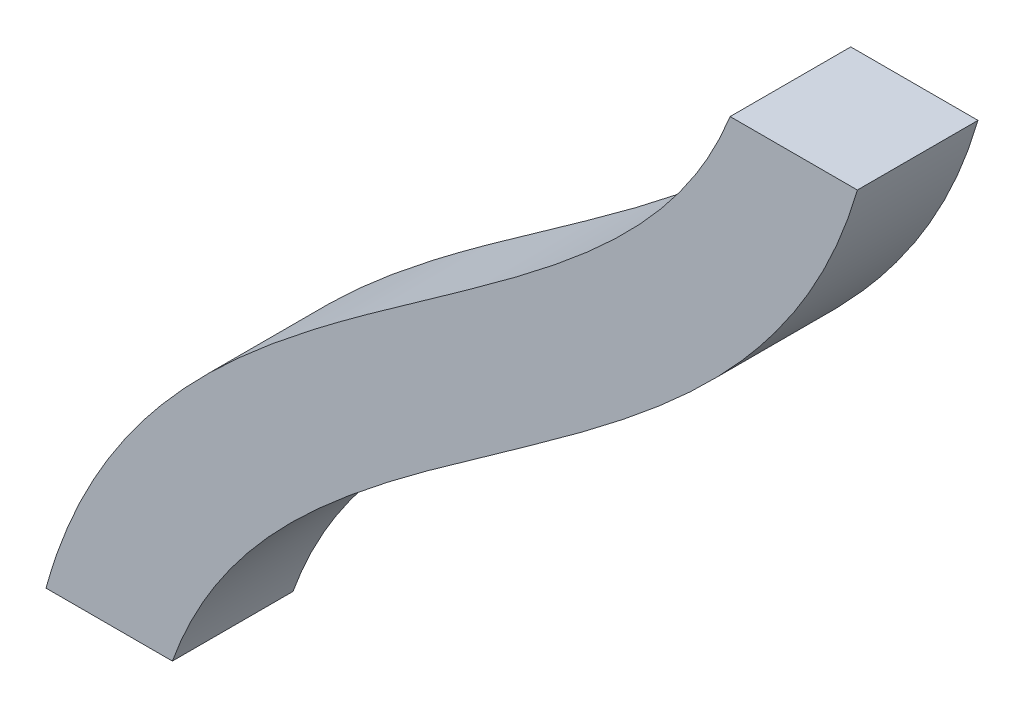
from build123d import *

# Parameters (mm, degrees)
SWEEP_START         = -35
SWEEP_1_DEPTH       = 70
CUT_EXTRUDE_2_DEPTH = 50
SKETCH_5_W          = 140.372929197
SKETCH_5_H          = 70.259224127
CUT_EXTRUDE_3_DEPTH = 50


# Read off the part's stored shape, not the designer's step: 扫描1
with BuildPart() as part:
    # 扫描1 outline → 扫描1 (new body)
    with BuildSketch(Plane.XY.offset(SWEEP_START)):
        with BuildLine():
            Line((296.564615022, 274.38689053), (226.598573257, 276.567028069))
            add(Edge.make_bspline(
                [(226.598573257, 276.567028069), (226.122488542, 261.288284191), (224.451690955, 247.155649258), (219.089653574, 220.717489302), (215.399401116, 208.40919063), (206.235433473, 185.12649183), (200.758662752, 174.148786785), (188.150641595, 153.125870735), (181.016094816, 143.081433196), (157.330590321, 113.952712829), (138.463163827, 95.874728611), (96.477489777, 60.961246529), (73.38565364, 44.146471525), (25.481340147, 10.134618125), (0.673613184, -7.062926968), (-48.083061525, -43.949235156), (-72.047844266, -63.645210456), (-105.25054385, -96.916333242), (-115.856771287, -108.630774221), (-135.720134821, -133.60208084), (-144.976351275, -146.860833281), (-161.661047766, -175.147036825), (-169.086764703, -190.174737104), (-181.634547375, -222.113027169), (-186.754405107, -239.020863028), (-190.52902045, -256.889221865)],
                knots=[0, 0, 0, 0, 0.0625, 0.0625, 0.125, 0.125, 0.1875, 0.1875, 0.25, 0.25, 0.375, 0.375, 0.5, 0.5, 0.625, 0.625, 0.75, 0.75, 0.8125, 0.8125, 0.875, 0.875, 0.9375, 0.9375, 1, 1, 1, 1], degree=3))
            Line((-190.52902045, -256.889221865), (-122.040485139, -271.357135708))
            add(Edge.make_bspline(
                [(296.564615022, 274.38689053), (295.971282235, 255.345364054), (293.863748523, 237.229761394), (286.884130269, 202.815927489), (282.011058386, 186.520469888), (269.896218843, 155.740553252), (262.657506721, 141.259399135), (246.315238227, 114.009909757), (237.214978199, 101.240801032), (207.866328138, 65.147475641), (185.60467275, 44.035553396), (138.848901666, 5.155463629), (114.32837455, -12.633426756), (65.587356502, -47.239336738), (41.362115165, -64.055889638), (-4.305075435, -98.604883731), (-25.731189713, -116.330112712), (-54.086274953, -144.743631325), (-62.911215673, -154.516209977), (-79.101167015, -174.869471819), (-86.467097278, -185.448268211), (-99.58483824, -207.687275741), (-105.339412039, -219.347237708), (-115.077520317, -244.133969753), (-119.063262798, -257.263493763), (-122.040485139, -271.357135708)],
                knots=[0, 0, 0, 0, 0.0625, 0.0625, 0.125, 0.125, 0.1875, 0.1875, 0.25, 0.25, 0.375, 0.375, 0.5, 0.5, 0.625, 0.625, 0.75, 0.75, 0.8125, 0.8125, 0.875, 0.875, 0.9375, 0.9375, 1, 1, 1, 1], degree=3))
        make_face()
    extrude(amount=SWEEP_1_DEPTH)

    # 草图4 → 切除-拉伸2 (cut, symmetric)
    with BuildSketch(Plane.XY):
        Polygon((196.354363501, 196.934484181), (331.188865509, 196.934484181), (331.188865509, 351.743238219), (86.208590838, 351.743238219), align=None)
    extrude(amount=CUT_EXTRUDE_2_DEPTH, both=True, mode=Mode.SUBTRACT)

    # 草图5 → 切除-拉伸3 (cut, symmetric)
    with BuildSketch(Plane.XY):
        with Locations((-131.655915803, -273.68587269)):
            Rectangle(SKETCH_5_W, SKETCH_5_H)
    extrude(amount=CUT_EXTRUDE_3_DEPTH, both=True, mode=Mode.SUBTRACT)


solid = part.part
